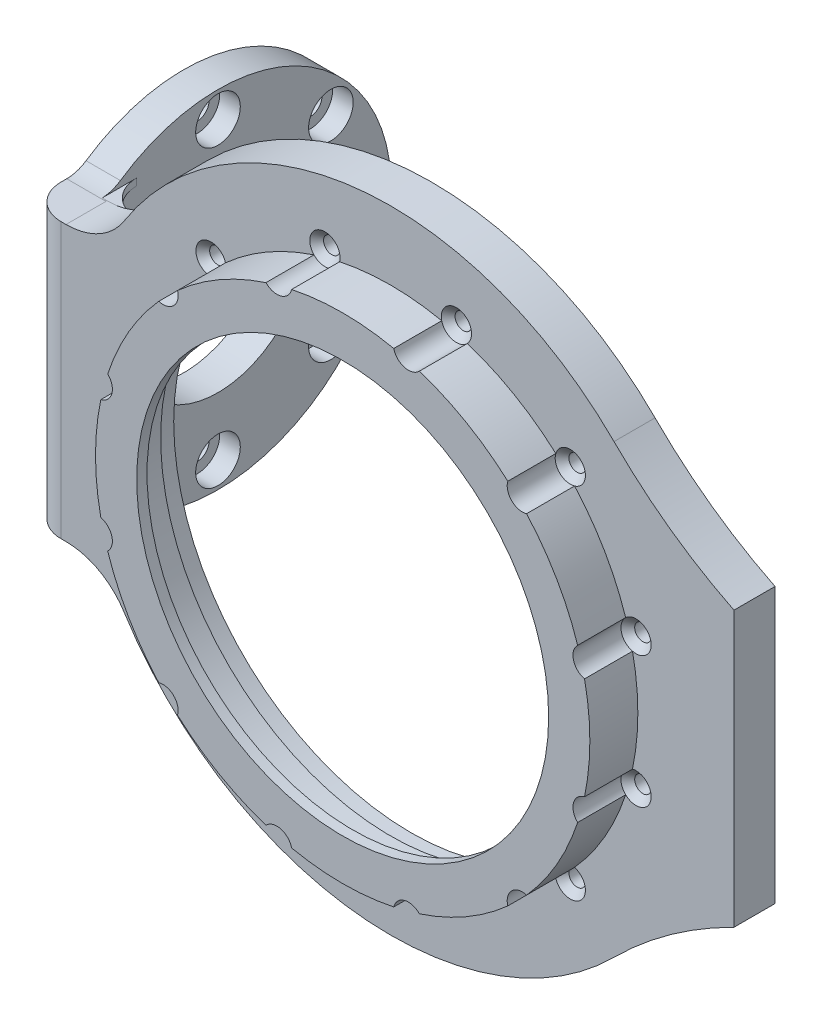
from build123d import *

# Parameters (mm, degrees)
SKETCH_3_R                   = 46
SKETCH_3_R_2                 = 34.6
EXTRUDE_2_DEPTH              = 3
SKETCH_5_R                   = 36
SKETCH_5_R_2                 = 33.5
EXTRUDE_3_DEPTH              = 5.49
EXTRUDE_START                = -2.98
SKETCH_2_R                   = 46
SKETCH_2_R_2                 = 41.6
EXTRUDE_1_DEPTH              = 2.98
SKETCH_6_R                   = 36
SKETCH_6_R_2                 = 30
EXTRUDE_4_DEPTH              = 1.5
EXTRUDE_5_DEPTH              = 3
EXTRUDE_5_DEPTH_BACK         = 2.98
HOLE_WIZARD_M2_1_AT_2_COUNT  = 2
HOLE_WIZARD_M2_1_AT_2_PITCH  = 64.085879878
HOLE_WIZARD_M2_1_AT_3_COUNT  = 2
HOLE_WIZARD_M2_1_AT_3_PITCH  = 71.478511138
HOLE_WIZARD_M2_1_AT_4_COUNT  = 2
HOLE_WIZARD_M2_1_AT_4_PITCH  = 73.999999995
HOLE_WIZARD_M2_1_AT_5_COUNT  = 2
HOLE_WIZARD_M2_1_AT_5_PITCH  = 19.15260934
HOLE_WIZARD_M2_1_AT_6_COUNT  = 2
HOLE_WIZARD_M2_1_AT_6_PITCH  = 36.999999998
HOLE_WIZARD_M2_1_AT_7_COUNT  = 2
HOLE_WIZARD_M2_1_AT_7_PITCH  = 52.325901805
HOLE_WIZARD_M2_1_AT_8_COUNT  = 2
HOLE_WIZARD_M2_1_AT_8_PITCH  = 71.47851114
HOLE_WIZARD_M2_1_AT_9_COUNT  = 2
HOLE_WIZARD_M2_1_AT_9_PITCH  = 64.085879872
HOLE_WIZARD_M2_1_AT_10_COUNT = 2
HOLE_WIZARD_M2_1_AT_10_PITCH = 52.325901805
HOLE_WIZARD_M2_1_AT_11_COUNT = 2
HOLE_WIZARD_M2_1_AT_11_PITCH = 36.999999994
HOLE_WIZARD_M2_1_AT_12_COUNT = 2
HOLE_WIZARD_M2_1_AT_12_PITCH = 19.152609334
CUT_EXTRUDE_1_REACH          = 70.3
SKETCH_13_R                  = 2.2
EXTRUDE_6_DEPTH              = 3
EXTRUDE_6_DEPTH_BACK         = 2
FILLET_1_R                   = 10
FILLET_2_R                   = 10
FILLET_3_R                   = 5
FILLET_4_R                   = 5
FILLET_5_R                   = 5
EXTRUDE_7_DEPTH              = 1
PATTERN_LINEAR_1_COUNT       = 8
PATTERN_LINEAR_1_PITCH       = 5.5722
CUT_EXTRUDE_START            = -7.98
SKETCH_18_R                  = 46
CUT_EXTRUDE_2_DEPTH          = 2
CUT_EXTRUDE_3_DEPTH          = 119.953814567
CUT_EXTRUDE_3_DEPTH_BACK     = 119.953814567
SKETCH_19_R                  = 13
HOLE_WIZARD_M3_1_AT_2_COUNT  = 2
HOLE_WIZARD_M3_1_AT_2_PITCH  = 18.144210967
HOLE_WIZARD_M3_1_AT_3_COUNT  = 2
HOLE_WIZARD_M3_1_AT_3_PITCH  = 18.144210967
HOLE_WIZARD_M3_1_AT_4_COUNT  = 2
HOLE_WIZARD_M3_1_AT_4_PITCH  = 38.910385988
HOLE_WIZARD_M3_1_AT_5_COUNT  = 2
HOLE_WIZARD_M3_1_AT_5_PITCH  = 42.932860717
HOLE_WIZARD_M3_1_AT_6_COUNT  = 2
HOLE_WIZARD_M3_1_AT_6_PITCH  = 38.910385988
CUT_EXTRUDE_START_2          = -15
SKETCH_21_R                  = 3.25
CUT_EXTRUDE_4_DEPTH          = 15


with BuildPart() as part:
    # 草图3 → 凸台-拉伸2 (new body)
    with BuildSketch(Plane.XY):
        Circle(SKETCH_3_R)
        Circle(SKETCH_3_R_2, mode=Mode.SUBTRACT)
    extrude(amount=EXTRUDE_2_DEPTH)

    # 草图5 → 凸台-拉伸3 (add)
    with BuildSketch(Plane.XY.offset(3)):
        Circle(SKETCH_5_R)
        Circle(SKETCH_5_R_2, mode=Mode.SUBTRACT)
    extrude(amount=EXTRUDE_3_DEPTH)

    # 草图2 → 凸台-拉伸1 (add)
    with BuildSketch(Plane.XY.offset(EXTRUDE_START)):
        Circle(SKETCH_2_R)
        Circle(SKETCH_2_R_2, mode=Mode.SUBTRACT)
    extrude(amount=EXTRUDE_1_DEPTH)

    # 草图6 → 凸台-拉伸4 (add)
    with BuildSketch(Plane.XY.offset(8.49)):
        Circle(SKETCH_6_R)
        Circle(SKETCH_6_R_2, mode=Mode.SUBTRACT)
    extrude(amount=EXTRUDE_4_DEPTH)

    # 草图8 → 凸台-拉伸5 (add, two sides: drawn at the far end of the back side and taken through both)
    with BuildSketch(Plane.XY.offset(-EXTRUDE_5_DEPTH_BACK)):
        with BuildLine():
            Line((-50, -20), (-50, 20))
            Line((-50, 20), (-41.424630354, 20))
            ThreePointArc((-41.424630354, 20), (-46, 0), (-41.424630354, -20))
            Line((-41.424630354, -20), (-50, -20))
        make_face()
        with BuildLine():
            Line((50, -20), (50, 20))
            ThreePointArc((50, 20), (40.750582015, 25.548076808), (32.526911935, 32.526911935))
            ThreePointArc((32.526911935, 32.526911935), (46, 0), (32.526911935, -32.526911935))
            ThreePointArc((32.526911935, -32.526911935), (40.750582015, -25.548076808), (50, -20))
        make_face()
    extrude(amount=EXTRUDE_5_DEPTH + EXTRUDE_5_DEPTH_BACK)

    # 草图12 → M2 锥坑平头的锥孔1 (revolve, cut)
    with BuildSketch(Plane(origin=(-35.73925557, -9.57630467, 3), x_dir=(0, -1, 0), z_dir=(1, 0, 0))):
        Polygon((0, 0), (0, 5.98), (1.2, 5.98), (1.2, 1), (2.2, 0), align=None)
    hole_wizard_m2_1 = revolve(axis=Axis((-35.73925557, -9.57630467, 9.35), (0, 0, -1)), mode=Mode.SUBTRACT)

    # M2 锥坑平头的锥孔1 at 2: M2 锥坑平头的锥孔1 ×2
    with Locations(*[Vector(0.7071067811865475, 0.7071067811865476, 0) * (i * HOLE_WIZARD_M2_1_AT_2_PITCH) for i in range(1, HOLE_WIZARD_M2_1_AT_2_COUNT)]):
        add(hole_wizard_m2_1, mode=Mode.SUBTRACT)

    # M2 锥坑平头的锥孔1 at 3: M2 锥坑平头的锥孔1 ×2
    with Locations(*[Vector(0.8660254037776919, 0.500000000011686, 0) * (i * HOLE_WIZARD_M2_1_AT_3_PITCH) for i in range(1, HOLE_WIZARD_M2_1_AT_3_COUNT)]):
        add(hole_wizard_m2_1, mode=Mode.SUBTRACT)

    # M2 锥坑平头的锥孔1 at 4: M2 锥坑平头的锥孔1 ×2
    with Locations(*[Vector(0.9659258262760346, 0.2588190451511635, 0) * (i * HOLE_WIZARD_M2_1_AT_4_PITCH) for i in range(1, HOLE_WIZARD_M2_1_AT_4_COUNT)]):
        add(hole_wizard_m2_1, mode=Mode.SUBTRACT)

    # M2 锥坑平头的锥孔1 at 5: M2 锥坑平头的锥孔1 ×2
    with Locations(*[(0, i * HOLE_WIZARD_M2_1_AT_5_PITCH, 0) for i in range(1, HOLE_WIZARD_M2_1_AT_5_COUNT)]):
        add(hole_wizard_m2_1, mode=Mode.SUBTRACT)

    # M2 锥坑平头的锥孔1 at 6: M2 锥坑平头的锥孔1 ×2
    with Locations(*[Vector(0.25881904515116333, 0.9659258262760346, 0) * (i * HOLE_WIZARD_M2_1_AT_6_PITCH) for i in range(1, HOLE_WIZARD_M2_1_AT_6_COUNT)]):
        add(hole_wizard_m2_1, mode=Mode.SUBTRACT)

    # M2 锥坑平头的锥孔1 at 7: M2 锥坑平头的锥孔1 ×2
    with Locations(*[Vector(0.4999999999563881, 0.866025403809618, 0) * (i * HOLE_WIZARD_M2_1_AT_7_PITCH) for i in range(1, HOLE_WIZARD_M2_1_AT_7_COUNT)]):
        add(hole_wizard_m2_1, mode=Mode.SUBTRACT)

    # M2 锥坑平头的锥孔1 at 8: M2 锥坑平头的锥孔1 ×2
    with Locations(*[(i * HOLE_WIZARD_M2_1_AT_8_PITCH, 0, 0) for i in range(1, HOLE_WIZARD_M2_1_AT_8_COUNT)]):
        add(hole_wizard_m2_1, mode=Mode.SUBTRACT)

    # M2 锥坑平头的锥孔1 at 9: M2 锥坑平头的锥孔1 ×2
    with Locations(*[Vector(0.9659258263021021, -0.2588190450538782, 0) * (i * HOLE_WIZARD_M2_1_AT_9_PITCH) for i in range(1, HOLE_WIZARD_M2_1_AT_9_COUNT)]):
        add(hole_wizard_m2_1, mode=Mode.SUBTRACT)

    # M2 锥坑平头的锥孔1 at 10: M2 锥坑平头的锥孔1 ×2
    with Locations(*[Vector(0.8660254038096179, -0.4999999999563883, 0) * (i * HOLE_WIZARD_M2_1_AT_10_PITCH) for i in range(1, HOLE_WIZARD_M2_1_AT_10_COUNT)]):
        add(hole_wizard_m2_1, mode=Mode.SUBTRACT)

    # M2 锥坑平头的锥孔1 at 11: M2 锥坑平头的锥孔1 ×2
    with Locations(*[Vector(0.7071067811865475, -0.7071067811865477, 0) * (i * HOLE_WIZARD_M2_1_AT_11_PITCH) for i in range(1, HOLE_WIZARD_M2_1_AT_11_COUNT)]):
        add(hole_wizard_m2_1, mode=Mode.SUBTRACT)

    # M2 锥坑平头的锥孔1 at 12: M2 锥坑平头的锥孔1 ×2
    with Locations(*[Vector(0.5000000001627614, -0.8660254036904684, 0) * (i * HOLE_WIZARD_M2_1_AT_12_PITCH) for i in range(1, HOLE_WIZARD_M2_1_AT_12_COUNT)]):
        add(hole_wizard_m2_1, mode=Mode.SUBTRACT)

    # 草图13 → 切除-拉伸1 (cut, up to next)
    with BuildSketch(Plane.XY.offset(3), mode=Mode.PRIVATE) as cut_extrude_1_sk1:
        with Locations((-35.73925557, -9.57630467)):
            Circle(SKETCH_13_R)
    cut_extrude_1_tool1 = extrude(cut_extrude_1_sk1.sketch, amount=CUT_EXTRUDE_1_REACH, mode=Mode.PRIVATE) & part.part
    # 草图13 → 切除-拉伸1 (cut, up to next)
    with BuildSketch(Plane.XY.offset(3), mode=Mode.PRIVATE) as cut_extrude_1_sk2:
        with Locations((-26.1629509, -26.1629509)):
            Circle(SKETCH_13_R)
    cut_extrude_1_tool2 = extrude(cut_extrude_1_sk2.sketch, amount=CUT_EXTRUDE_1_REACH, mode=Mode.PRIVATE) & part.part
    # 草图13 → 切除-拉伸1 (cut, up to next)
    with BuildSketch(Plane.XY.offset(3), mode=Mode.PRIVATE) as cut_extrude_1_sk3:
        with Locations((-35.73925557, 9.57630467)):
            Circle(SKETCH_13_R)
    cut_extrude_1_tool3 = extrude(cut_extrude_1_sk3.sketch, amount=CUT_EXTRUDE_1_REACH, mode=Mode.PRIVATE) & part.part
    # 草图13 → 切除-拉伸1 (cut, up to next)
    with BuildSketch(Plane.XY.offset(3), mode=Mode.PRIVATE) as cut_extrude_1_sk4:
        with Locations((-26.1629509, 26.1629509)):
            Circle(SKETCH_13_R)
    cut_extrude_1_tool4 = extrude(cut_extrude_1_sk4.sketch, amount=CUT_EXTRUDE_1_REACH, mode=Mode.PRIVATE) & part.part
    # 草图13 → 切除-拉伸1 (cut, up to next)
    with BuildSketch(Plane.XY.offset(3), mode=Mode.PRIVATE) as cut_extrude_1_sk5:
        with Locations((-9.57630467, 35.73925557)):
            Circle(SKETCH_13_R)
    cut_extrude_1_tool5 = extrude(cut_extrude_1_sk5.sketch, amount=CUT_EXTRUDE_1_REACH, mode=Mode.PRIVATE) & part.part
    # 草图13 → 切除-拉伸1 (cut, up to next)
    with BuildSketch(Plane.XY.offset(3), mode=Mode.PRIVATE) as cut_extrude_1_sk6:
        with Locations((26.1629509, 26.1629509)):
            Circle(SKETCH_13_R)
    cut_extrude_1_tool6 = extrude(cut_extrude_1_sk6.sketch, amount=CUT_EXTRUDE_1_REACH, mode=Mode.PRIVATE) & part.part
    # 草图13 → 切除-拉伸1 (cut, up to next)
    with BuildSketch(Plane.XY.offset(3), mode=Mode.PRIVATE) as cut_extrude_1_sk7:
        with Locations((35.73925557, 9.57630467)):
            Circle(SKETCH_13_R)
    cut_extrude_1_tool7 = extrude(cut_extrude_1_sk7.sketch, amount=CUT_EXTRUDE_1_REACH, mode=Mode.PRIVATE) & part.part
    # 草图13 → 切除-拉伸1 (cut, up to next)
    with BuildSketch(Plane.XY.offset(3), mode=Mode.PRIVATE) as cut_extrude_1_sk8:
        with Locations((35.73925557, -9.57630467)):
            Circle(SKETCH_13_R)
    cut_extrude_1_tool8 = extrude(cut_extrude_1_sk8.sketch, amount=CUT_EXTRUDE_1_REACH, mode=Mode.PRIVATE) & part.part
    # 草图13 → 切除-拉伸1 (cut, up to next)
    with BuildSketch(Plane.XY.offset(3), mode=Mode.PRIVATE) as cut_extrude_1_sk9:
        with Locations((9.57630467, -35.73925557)):
            Circle(SKETCH_13_R)
    cut_extrude_1_tool9 = extrude(cut_extrude_1_sk9.sketch, amount=CUT_EXTRUDE_1_REACH, mode=Mode.PRIVATE) & part.part
    # 草图13 → 切除-拉伸1 (cut, up to next)
    with BuildSketch(Plane.XY.offset(3), mode=Mode.PRIVATE) as cut_extrude_1_sk10:
        with Locations((-9.57630467, -35.73925557)):
            Circle(SKETCH_13_R)
    cut_extrude_1_tool10 = extrude(cut_extrude_1_sk10.sketch, amount=CUT_EXTRUDE_1_REACH, mode=Mode.PRIVATE) & part.part
    # 草图13 → 切除-拉伸1 (cut, up to next)
    with BuildSketch(Plane.XY.offset(3), mode=Mode.PRIVATE) as cut_extrude_1_sk11:
        with Locations((9.57630467, 35.73925557)):
            Circle(SKETCH_13_R)
    cut_extrude_1_tool11 = extrude(cut_extrude_1_sk11.sketch, amount=CUT_EXTRUDE_1_REACH, mode=Mode.PRIVATE) & part.part
    # 草图13 → 切除-拉伸1 (cut, up to next)
    with BuildSketch(Plane.XY.offset(3), mode=Mode.PRIVATE) as cut_extrude_1_sk12:
        with Locations((26.1629509, -26.1629509)):
            Circle(SKETCH_13_R)
    cut_extrude_1_tool12 = extrude(cut_extrude_1_sk12.sketch, amount=CUT_EXTRUDE_1_REACH, mode=Mode.PRIVATE) & part.part
    add(cut_extrude_1_tool1.solids().sort_by_distance((-35.739256, -9.576305, 3))[0], mode=Mode.SUBTRACT)
    add(cut_extrude_1_tool2.solids().sort_by_distance((-26.162951, -26.162951, 3))[0], mode=Mode.SUBTRACT)
    add(cut_extrude_1_tool3.solids().sort_by_distance((-35.739256, 9.576305, 3))[0], mode=Mode.SUBTRACT)
    add(cut_extrude_1_tool4.solids().sort_by_distance((-26.162951, 26.162951, 3))[0], mode=Mode.SUBTRACT)
    add(cut_extrude_1_tool5.solids().sort_by_distance((-9.576305, 35.739256, 3))[0], mode=Mode.SUBTRACT)
    add(cut_extrude_1_tool6.solids().sort_by_distance((26.162951, 26.162951, 3))[0], mode=Mode.SUBTRACT)
    add(cut_extrude_1_tool7.solids().sort_by_distance((35.739256, 9.576305, 3))[0], mode=Mode.SUBTRACT)
    add(cut_extrude_1_tool8.solids().sort_by_distance((35.739256, -9.576305, 3))[0], mode=Mode.SUBTRACT)
    add(cut_extrude_1_tool9.solids().sort_by_distance((9.576305, -35.739256, 3))[0], mode=Mode.SUBTRACT)
    add(cut_extrude_1_tool10.solids().sort_by_distance((-9.576305, -35.739256, 3))[0], mode=Mode.SUBTRACT)
    add(cut_extrude_1_tool11.solids().sort_by_distance((9.576305, 35.739256, 3))[0], mode=Mode.SUBTRACT)
    add(cut_extrude_1_tool12.solids().sort_by_distance((26.162951, -26.162951, 3))[0], mode=Mode.SUBTRACT)

    # 草图14 → 凸台-拉伸6 (add, two sides: drawn at the far end of the back side and taken through both)
    with BuildSketch(Plane.ZY.offset(50).offset(-EXTRUDE_6_DEPTH_BACK)):
        with BuildLine():
            Line((-4.436937358, 20), (3, 20))
            Line((3, 20), (3, -20))
            Line((3, -20), (-4.436937358, -20))
            ThreePointArc((-4.436937358, -20), (-45.1, 0), (-4.436937358, 20))
        make_face()
    extrude(amount=EXTRUDE_6_DEPTH + EXTRUDE_6_DEPTH_BACK)

    # 圆角1
    fillet_1_edges = [part.edges().sort_by_distance(p)[0] for p in [
        (-41.424630354, 20, 0.01),
    ]]
    fillet(fillet_1_edges, radius=FILLET_1_R)

    # 圆角2
    fillet_2_edges = [part.edges().sort_by_distance(p)[0] for p in [
        (-41.424630354, -20, 0.01),
    ]]
    fillet(fillet_2_edges, radius=FILLET_2_R)

    # 圆角3
    # the kernel refuses this fillet: 5 mm, written as the material it adds along each edge
    with BuildSketch(Plane(origin=(-43.954603279, 20, -4.436937358), x_dir=(0, 0, 1), z_dir=(-1, 0, 0))) as fillet_3_piece_1_section:
        with BuildLine():
            CenterArc((1.618158688, 5), FILLET_3_R, 235.735397106, 34.264602894)
            ThreePointArc((-1.196919217, 0.867768595), (-0.592107254, 0.442646144), (0, 0))
            Line((0, 0), (1.618158688, 0))
        make_face()
    fillet_3_piece_1 = extrude(amount=9.045396721, mode=Mode.PRIVATE)
    fillet_3_piece_1 = split(fillet_3_piece_1, bisect_by=Plane(origin=(-47.698017954, 20.000730506, -2.98), z_dir=(0, 0, 1)), keep=Keep.TOP, mode=Mode.PRIVATE)
    fillet_3_piece_1 = fillet_3_piece_1 - Plane(origin=(-47.28636167, 30, -2.938164072), x_dir=(0.8443993155383497, -0.5357142857142851, 0), z_dir=(0, 0, 1)) * Cylinder(10, 25, mode=Mode.PRIVATE)
    add(fillet_3_piece_1)
    with BuildSketch(Plane(origin=(-48, 20, -4.436937358), x_dir=(0, 0, 1), z_dir=(-1, 0, 0))) as fillet_3_piece_2:
        with BuildLine():
            CenterArc((1.618158688, 5), FILLET_3_R, 235.735397106, 34.264602894)
            ThreePointArc((-1.196919217, 0.867768595), (-0.592107254, 0.442646144), (0, 0))
            Line((0, 0), (1.618158688, 0))
        make_face()
    extrude(amount=5)

    # 圆角4
    fillet_4_edges = [part.edges().sort_by_distance(p)[0] for p in [
        (-53, 0, 3),
    ]]
    fillet(fillet_4_edges, radius=FILLET_4_R)

    # 圆角5
    # the kernel refuses this fillet: 5 mm, written as the material it adds along each edge
    with BuildSketch(Plane(origin=(-43.954603279, -20, -4.436937358), x_dir=(0, 0, 1), z_dir=(-1, 0, 0))) as fillet_5_piece_1_section:
        with BuildLine():
            CenterArc((1.618158688, -5), FILLET_5_R, 90, 34.264602894)
            ThreePointArc((-1.196919217, -0.867768595), (-0.592107254, -0.442646144), (0, 0))
            Line((0, 0), (1.618158688, 0))
        make_face()
    fillet_5_piece_1 = extrude(amount=9.045396721, mode=Mode.PRIVATE)
    fillet_5_piece_1 = fillet_5_piece_1 - Plane(origin=(-47.28636167, -30, -2.938164073), x_dir=(0, 1, 0), z_dir=(0, 0, -1)) * Cylinder(10, 25, mode=Mode.PRIVATE)
    fillet_5_piece_1 = split(fillet_5_piece_1, bisect_by=Plane(origin=(-47.698017954, -20.000730506, -2.98), z_dir=(0, 0, 1)), keep=Keep.TOP, mode=Mode.PRIVATE)
    add(fillet_5_piece_1)
    with BuildSketch(Plane(origin=(-48, -20, -4.436937358), x_dir=(0, 0, 1), z_dir=(-1, 0, 0))) as fillet_5_piece_2:
        with BuildLine():
            CenterArc((1.618158688, -5), FILLET_5_R, 90, 34.264602894)
            ThreePointArc((-1.196919217, -0.867768595), (-0.592107254, -0.442646144), (0, 0))
            Line((0, 0), (1.618158688, 0))
        make_face()
    extrude(amount=5)

    # 草图17 → 凸台-拉伸7 (add)
    with BuildSketch(Plane(origin=(-48, -20.002599908, -2.98), x_dir=(1, 0, 0), z_dir=(0, 1, 0))):
        with BuildLine():
            Line((0, 0), (0, 5))
            ThreePointArc((0, 5), (1.464466094, 1.464466094), (5, 0))
            Line((5, 0), (0, 0))
        make_face()
    extrude_7 = extrude(amount=EXTRUDE_7_DEPTH)

    # 阵列(线性)1: 凸台-拉伸7 ×8, 2 skipped
    with Locations(*[(0, i * PATTERN_LINEAR_1_PITCH, 0) for i in range(1, PATTERN_LINEAR_1_COUNT) if i not in (1, 6)]):
        add(extrude_7)

    # 草图18 → 切除-拉伸2 (cut)
    with BuildSketch(Plane.XY.offset(3).offset(CUT_EXTRUDE_START)):
        Circle(SKETCH_18_R)
    extrude(amount=CUT_EXTRUDE_2_DEPTH, mode=Mode.SUBTRACT)

    # 草图19 → 切除-拉伸3 (cut, two sides: drawn at the far end of the back side and taken through both)
    with BuildSketch(Plane.ZY.offset(50).offset(-CUT_EXTRUDE_3_DEPTH_BACK)):
        with Locations((-19.85, 0)):
            Circle(SKETCH_19_R)
    extrude(amount=CUT_EXTRUDE_3_DEPTH + CUT_EXTRUDE_3_DEPTH_BACK, mode=Mode.SUBTRACT)

    # 草图20 → M3 六角凹头盖的柱孔1 (revolve, cut)
    with BuildSketch(Plane(origin=(-48, 21.466430357, -19.85), x_dir=(0, 0, -1), z_dir=(0, 1, 0))):
        Polygon((0, 0), (0, 5), (1.7, 5), (1.7, 3), (3.25, 3), (3.25, 0), align=None)
    hole_wizard_m3_1 = revolve(axis=Axis((-41.65, 21.466430357, -19.85), (-1, 0, 0)), mode=Mode.SUBTRACT)

    # M3 六角凹头盖的柱孔1 at 2: M3 六角凹头盖的柱孔1 ×2
    with Locations(*[Vector(0, -0.42261826174070016, -0.9063077870366497) * (i * HOLE_WIZARD_M3_1_AT_2_PITCH) for i in range(1, HOLE_WIZARD_M3_1_AT_2_COUNT)]):
        add(hole_wizard_m3_1, mode=Mode.SUBTRACT)

    # M3 六角凹头盖的柱孔1 at 3: M3 六角凹头盖的柱孔1 ×2
    with Locations(*[Vector(0, -0.4226182616258053, 0.9063077870902261) * (i * HOLE_WIZARD_M3_1_AT_3_PITCH) for i in range(1, HOLE_WIZARD_M3_1_AT_3_COUNT)]):
        add(hole_wizard_m3_1, mode=Mode.SUBTRACT)

    # M3 六角凹头盖的柱孔1 at 4: M3 六角凹头盖的柱孔1 ×2
    with Locations(*[Vector(0, -0.9063077870353761, -0.42261826174343137) * (i * HOLE_WIZARD_M3_1_AT_4_PITCH) for i in range(1, HOLE_WIZARD_M3_1_AT_4_COUNT)]):
        add(hole_wizard_m3_1, mode=Mode.SUBTRACT)

    # M3 六角凹头盖的柱孔1 at 5: M3 六角凹头盖的柱孔1 ×2
    with Locations(*[(0, -i * HOLE_WIZARD_M3_1_AT_5_PITCH, 0) for i in range(1, HOLE_WIZARD_M3_1_AT_5_COUNT)]):
        add(hole_wizard_m3_1, mode=Mode.SUBTRACT)

    # M3 六角凹头盖的柱孔1 at 6: M3 六角凹头盖的柱孔1 ×2
    with Locations(*[Vector(0, -0.9063077870353761, 0.42261826174343153) * (i * HOLE_WIZARD_M3_1_AT_6_PITCH) for i in range(1, HOLE_WIZARD_M3_1_AT_6_COUNT)]):
        add(hole_wizard_m3_1, mode=Mode.SUBTRACT)

    # 草图21 → 切除-拉伸4 (cut)
    with BuildSketch(Plane.ZY.offset(50).offset(CUT_EXTRUDE_START_2)):
        with Locations(Location((-3.40576031, 13.79835546, 0), (0, 0, 180))):
            Circle(SKETCH_21_R)
        with Locations(Location((-3.40576031, -13.79835546, 0), (0, 0, 180))):
            Circle(SKETCH_21_R)
    extrude(amount=CUT_EXTRUDE_4_DEPTH, mode=Mode.SUBTRACT)


solid = part.part
